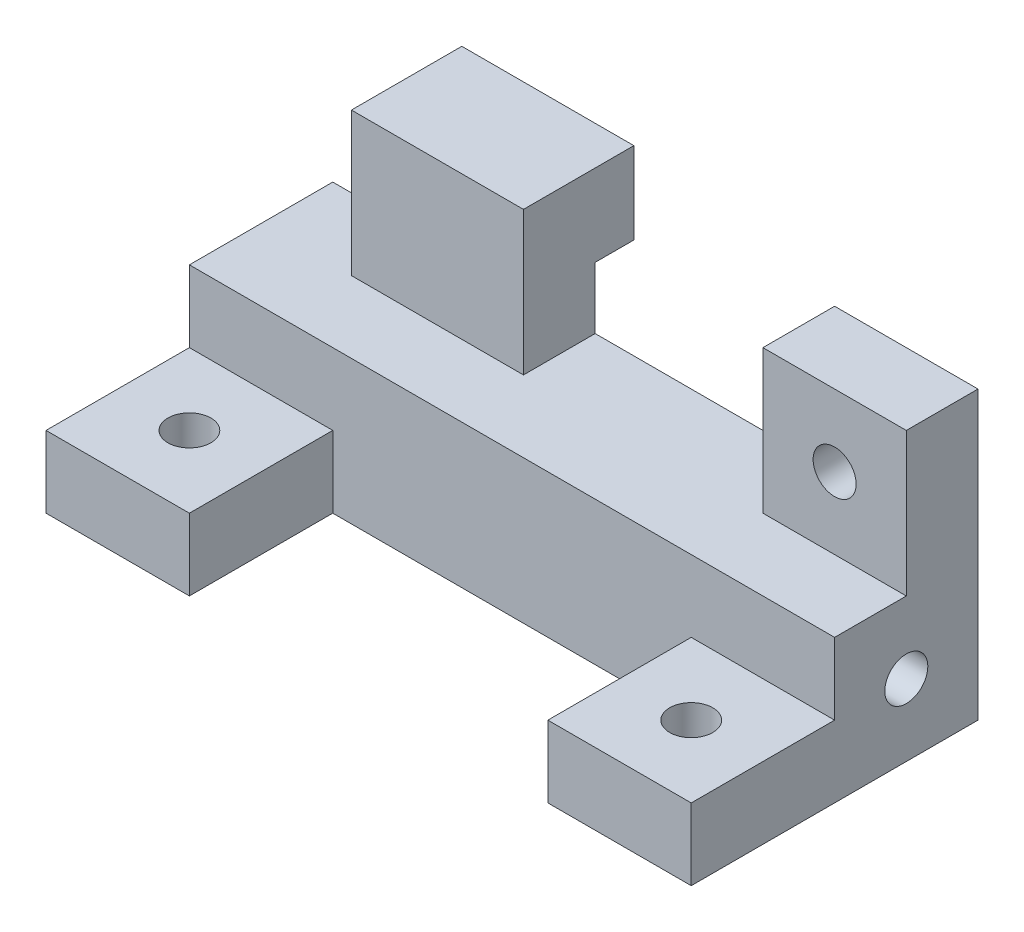
from build123d import *

# Parameters (mm, degrees)
SKETCH1_W           = 45
SKETCH1_H           = 10
BOSS_EXTRUDE1_DEPTH = 10
SKETCH2_W           = 10
SKETCH2_H           = 5
SKETCH2_W_2         = 12
BOSS_EXTRUDE2_DEPTH = 10
SKETCH3_W           = 10
SKETCH3_H           = 5
BOSS_EXTRUDE3_DEPTH = 10
SKETCH4_R           = 1.5
CUT_EXTRUDE1_DEPTH  = 5
SKETCH6_R           = 1.5
CUT_EXTRUDE3_DEPTH  = 5
CUT_EXTRUDE4_START  = -5
SKETCH7_R           = 1.5
CUT_EXTRUDE4_DEPTH  = 5
SKETCH9_R           = 1.5
CUT_EXTRUDE6_DEPTH  = 5
SKETCH10_R          = 1.5
CUT_EXTRUDE7_DEPTH  = 5
SKETCH11_W          = 12
SKETCH11_H          = 5.7
BOSS_EXTRUDE4_DEPTH = 2.7


with BuildPart() as part:
    # Sketch1 → Boss-Extrude1 (new body)
    with BuildSketch(Plane.XY):
        with Locations((22.5, 5)):
            Rectangle(SKETCH1_W, SKETCH1_H)
    extrude(amount=BOSS_EXTRUDE1_DEPTH)

    # Sketch2 → Boss-Extrude2 (add)
    with BuildSketch(Plane(origin=(0, 10, 0), x_dir=(1, 0, 0), z_dir=(0, 1, 0))):
        with Locations((40, -2.5)):
            Rectangle(SKETCH2_W, SKETCH2_H)
        with Locations((12.3, -2.5)):
            Rectangle(SKETCH2_W_2, SKETCH2_H)
    extrude(amount=BOSS_EXTRUDE2_DEPTH)

    # Sketch3 → Boss-Extrude3 (add)
    with BuildSketch(Plane.XY.offset(10)):
        with Locations((5, 2.5)):
            Rectangle(SKETCH3_W, SKETCH3_H)
        with Locations((40, 2.5)):
            Rectangle(SKETCH3_W, SKETCH3_H)
    extrude(amount=BOSS_EXTRUDE3_DEPTH)

    # Sketch4 → Cut-Extrude1 (cut)
    with BuildSketch(Plane.ZY):
        with Locations((5, 5)):
            Circle(SKETCH4_R)
    extrude(amount=-CUT_EXTRUDE1_DEPTH, mode=Mode.SUBTRACT)

    # Sketch6 → Cut-Extrude3 (cut)
    with BuildSketch(Plane(origin=(0, 5, 0), x_dir=(1, 0, 0), z_dir=(0, 1, 0))):
        with Locations((5, -15)):
            Circle(SKETCH6_R)
    extrude(amount=-CUT_EXTRUDE3_DEPTH, mode=Mode.SUBTRACT)

    # Sketch7 → Cut-Extrude4 (cut)
    with BuildSketch(Plane(origin=(45, 0, 0), x_dir=(0, 0, -1), z_dir=(1, 0, 0)).offset(CUT_EXTRUDE4_START)):
        with Locations((-5, 5)):
            Circle(SKETCH7_R)
    extrude(amount=CUT_EXTRUDE4_DEPTH, mode=Mode.SUBTRACT)

    # Sketch9 → Cut-Extrude6 (cut)
    with BuildSketch(Plane(origin=(0, 5, 0), x_dir=(1, 0, 0), z_dir=(0, 1, 0))):
        with Locations((40, -15)):
            Circle(SKETCH9_R)
    extrude(amount=-CUT_EXTRUDE6_DEPTH, mode=Mode.SUBTRACT)

    # Sketch10 → Cut-Extrude7 (cut)
    with BuildSketch(Plane.XY.offset(5)):
        with Locations((40, 15)):
            Circle(SKETCH10_R)
    extrude(amount=-CUT_EXTRUDE7_DEPTH, mode=Mode.SUBTRACT)

    # Sketch11 → Boss-Extrude4 (add)
    with BuildSketch(Plane(origin=(0, 0, 0), x_dir=(-1, 0, 0), z_dir=(0, 0, -1))):
        with Locations((-12.3, 17.15)):
            Rectangle(SKETCH11_W, SKETCH11_H)
    extrude(amount=BOSS_EXTRUDE4_DEPTH)


solid = part.part
